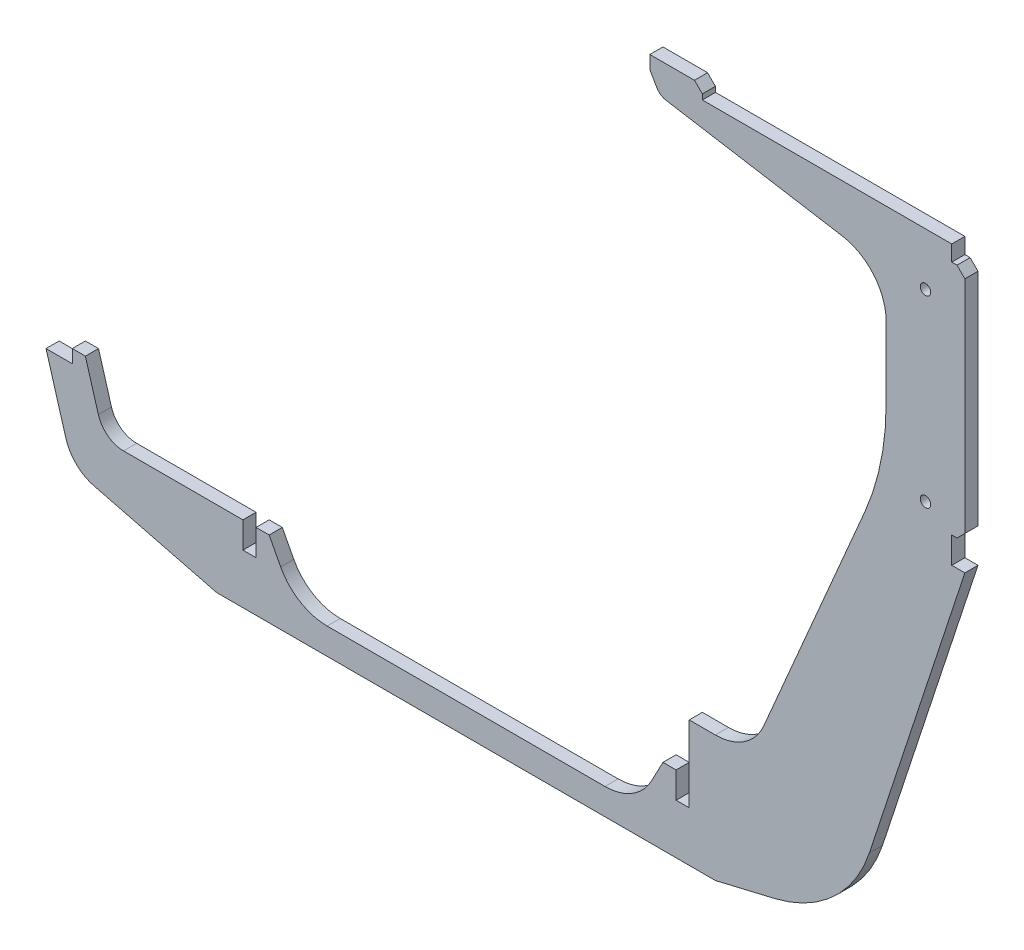
from build123d import *

# Parameters (mm, degrees)
SZKIC1_R                    = 2
DODANIE_WYCI_GNI_CIE1_DEPTH = 5


with BuildPart() as part:
    # Szkic1 → Dodanie-wyciągnięcie1 (new body)
    with BuildSketch(Plane.XY):
        with BuildLine():
            Line((81.708995713, -73.826238722), (-108.291004287, -73.826238722))
            Line((-108.291004287, -73.826238722), (-154.992958668, -61.995076946))
            ThreePointArc((-154.992958668, -61.995076946), (-161.71569568, -58.257537013), (-165.70204741, -51.679285151))
            Line((-165.70204741, -51.679285151), (-173.291004287, -25.826238722))
            Line((-173.291004287, -25.826238722), (-163.291004287, -25.826238722))
            Line((-163.291004287, -25.826238722), (-163.291004287, -20.826238722))
            Line((-163.291004287, -20.826238722), (-158.291004287, -20.826238722))
            Line((-158.291004287, -20.826238722), (-153.354630556, -37.642818566))
            ThreePointArc((-153.354630556, -37.642818566), (-149.752569637, -42.831418247), (-143.759481887, -44.826238722))
            Line((-143.759481887, -44.826238722), (-98.291004287, -44.826238722))
            Line((-98.291004287, -44.826238722), (-98.291004287, -54.826238722))
            Line((-98.291004287, -54.826238722), (-93.291004287, -54.826238722))
            Line((-93.291004287, -54.826238722), (-93.291004287, -44.826238722))
            Line((-93.291004287, -44.826238722), (-88.291004287, -44.826238722))
            Line((-88.291004287, -44.826238722), (-83.914726047, -53.141167379))
            ThreePointArc((-83.914726047, -53.141167379), (-76.553223475, -60.947841643), (-66.216361599, -63.826238722))
            Line((-66.216361599, -63.826238722), (39.634353025, -63.826238722))
            ThreePointArc((39.634353025, -63.826238722), (49.9712149, -60.947841643), (57.332717472, -53.141167379))
            Line((57.332717472, -53.141167379), (61.708995713, -44.826238722))
            Line((61.708995713, -44.826238722), (66.708995713, -44.826238722))
            Line((66.708995713, -44.826238722), (66.708995713, -54.826238722))
            Line((66.708995713, -54.826238722), (71.708995713, -54.826238722))
            Line((71.708995713, -54.826238722), (71.708995713, -25.826238722))
            Line((71.708995713, -25.826238722), (81.663929696, -25.826238722))
            ThreePointArc((81.663929696, -25.826238722), (92.673749871, -22.523060567), (100.046830296, -13.704624694))
            Line((100.046830296, -13.704624694), (138.623498714, 76.307601615))
            ThreePointArc((138.623498714, 76.307601615), (144.666767993, 95.592944246), (146.708995713, 115.699531473))
            Line((146.708995713, 115.699531473), (146.708995713, 143.23121951))
            ThreePointArc((146.708995713, 143.23121951), (141.969395362, 156.158717433), (129.996975459, 162.959097987))
            Line((129.996975459, 162.959097987), (62.869971243, 174.146932023))
            ThreePointArc((62.869971243, 174.146932023), (60.843333311, 174.969730097), (59.36183916, 176.578901642))
            Line((59.36183916, 176.578901642), (56.708995713, 181.173761278))
            Line((56.708995713, 181.173761278), (56.708995713, 186.173761278))
            Line((56.708995713, 186.173761278), (73.708995713, 186.173761278))
            Line((73.708995713, 186.173761278), (76.708995713, 183.173761278))
            Line((76.708995713, 183.173761278), (76.708995713, 181.173761278))
            Line((76.708995713, 181.173761278), (171.708995713, 181.173761278))
            Line((171.708995713, 181.173761278), (171.708995713, 175.173761278))
            Line((171.708995713, 175.173761278), (173.708995713, 175.173761278))
            Line((173.708995713, 175.173761278), (176.708995713, 172.173761278))
            Line((176.708995713, 172.173761278), (176.708995713, 88.173761278))
            Line((176.708995713, 88.173761278), (173.708995713, 85.173761278))
            Line((173.708995713, 85.173761278), (171.708995713, 85.173761278))
            Line((171.708995713, 85.173761278), (171.708995713, 75.173761278))
            Line((171.708995713, 75.173761278), (176.708995713, 75.173761278))
            Line((176.708995713, 75.173761278), (140.320371024, -35.422346934))
            ThreePointArc((140.320371024, -35.422346934), (126.652185637, -56.615596175), (104.378764502, -68.442168635))
            Line((104.378764502, -68.442168635), (81.708995713, -73.826238722))
        make_face()
        with Locations((161.708995713, 91.173761278)):
            Circle(SZKIC1_R, mode=Mode.SUBTRACT)
        with Locations((161.708995713, 161.173761278)):
            Circle(SZKIC1_R, mode=Mode.SUBTRACT)
    extrude(amount=DODANIE_WYCI_GNI_CIE1_DEPTH)


solid = part.part
